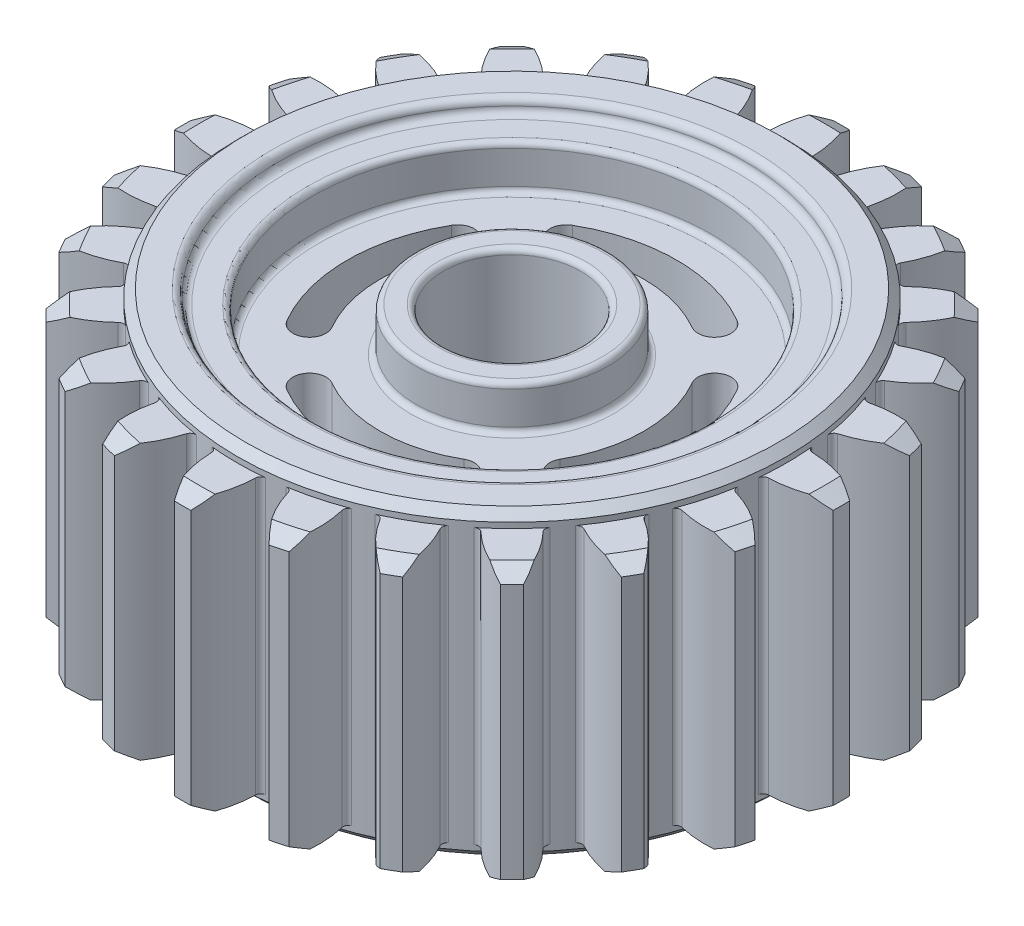
from build123d import *

# Parameters (mm, degrees)
SKETCH1_R           = 42.5
SKETCH1_R_2         = 12.5
BOSS_EXTRUDE1_DEPTH = 25
SKETCH1_3_R         = 50
SKETCH1_3_R_2       = 42.5
BOSS_EXTRUDE2_DEPTH = 27.5
BOSS_EXTRUDE3_DEPTH = 25
FILLET1_R           = 1.25
CHAMFER1_SIZE       = 1.5
FILLET2_R           = 1
SKETCH3_R           = 36.25
SKETCH3_R_2         = 17.5
CUT_EXTRUDE1_DEPTH  = 8
CUT_EXTRUDE2_REACH  = 97.814
FILLET3_R           = 1


with BuildPart() as part:
    # Sketch1 → Boss-Extrude1 (new, symmetric)
    with BuildSketch(Plane(origin=(0, 0, 0), x_dir=(1, 0, 0), z_dir=(0, 1, 0))):
        with Locations(Location((0, 0, 0), (0, 0, 270))):
            Circle(SKETCH1_R)
        with Locations(Location((0, 0, 0), (0, 0, 270))):
            Circle(SKETCH1_R_2, mode=Mode.SUBTRACT)
    extrude(amount=BOSS_EXTRUDE1_DEPTH, both=True)

    # Sketch1<3> → Boss-Extrude2 (add, symmetric)
    with BuildSketch(Plane(origin=(0, 0, 0), x_dir=(1, 0, 0), z_dir=(0, 1, 0))):
        with Locations(Location((0, 0, 0), (0, 0, 270))):
            Circle(SKETCH1_3_R)
        with Locations(Location((0, 0, 0), (0, 0, 270))):
            Circle(SKETCH1_3_R_2, mode=Mode.SUBTRACT)
    extrude(amount=BOSS_EXTRUDE2_DEPTH, both=True)

    # Sketch1<4> → Boss-Extrude3 (add, symmetric)
    with BuildSketch(Plane(origin=(0, 0, 0), x_dir=(1, 0, 0), z_dir=(0, 1, 0))):
        with BuildLine():
            ThreePointArc((41.16248371, 28.383973204), (43.301270189, 25), (45.16248371, 21.455769974))
            ThreePointArc((45.16248371, 21.455769974), (49.409590507, 24.573240926), (52.695283713, 28.691585429))
            ThreePointArc((52.695283713, 28.691585429), (51.961524227, 30), (51.195283713, 31.28966164))
            ThreePointArc((51.195283713, 31.28966164), (45.985846149, 30.503340107), (41.16248371, 28.383973204))
        make_face()
        with BuildLine():
            ThreePointArc((47.10621893, 16.763178043), (48.296291314, 12.940952255), (49.176771291, 9.035771432))
            ThreePointArc((49.176771291, 9.035771432), (54.086022289, 10.947785012), (58.325664205, 14.075400351))
            ThreePointArc((58.325664205, 14.075400351), (57.955549577, 15.529142706), (57.54920707, 16.97317783))
            ThreePointArc((57.54920707, 16.97317783), (52.313761798, 17.561951209), (47.10621893, 16.763178043))
        make_face()
        with BuildLine():
            ThreePointArc((49.839743178, 4), (49.95991973, 2.001604497), (50, 0))
            ThreePointArc((50, 0), (49.95991973, -2.001604497), (49.839743178, -4))
            ThreePointArc((49.839743178, -4), (55.076581033, -3.423744359), (59.981247069, -1.5))
            ThreePointArc((59.981247069, -1.5), (59.995311584, -0.75005861), (60, 0))
            ThreePointArc((60, 0), (59.995311584, 0.75005861), (59.981247069, 1.5))
            ThreePointArc((59.981247069, 1.5), (55.076581033, 3.423744359), (49.839743178, 4))
        make_face()
        with BuildLine():
            ThreePointArc((58.325664205, -14.075400351), (54.086022289, -10.947785012), (49.176771291, -9.035771432))
            ThreePointArc((49.176771291, -9.035771432), (48.296291314, -12.940952255), (47.10621893, -16.763178043))
            ThreePointArc((47.10621893, -16.763178043), (52.313761798, -17.561951209), (57.54920707, -16.97317783))
            ThreePointArc((57.54920707, -16.97317783), (57.955549577, -15.529142706), (58.325664205, -14.075400351))
        make_face()
        with BuildLine():
            ThreePointArc((52.695283713, -28.691585429), (49.409590507, -24.573240926), (45.16248371, -21.455769974))
            ThreePointArc((45.16248371, -21.455769974), (43.301270189, -25), (41.16248371, -28.383973204))
            ThreePointArc((41.16248371, -28.383973204), (45.985846149, -30.503340107), (51.195283713, -31.28966164))
            ThreePointArc((51.195283713, -31.28966164), (51.961524227, -30), (52.695283713, -28.691585429))
        make_face()
        with BuildLine():
            ThreePointArc((43.473806719, -41.352486375), (41.365976786, -36.52407108), (38.070447498, -32.413593249))
            ThreePointArc((38.070447498, -32.413593249), (35.355339059, -35.355339059), (32.413593249, -38.070447498))
            ThreePointArc((32.413593249, -38.070447498), (36.52407108, -41.365976786), (41.352486375, -43.473806719))
            ThreePointArc((41.352486375, -43.473806719), (42.426406871, -42.426406871), (43.473806719, -41.352486375))
        make_face()
        with BuildLine():
            ThreePointArc((31.28966164, -51.195283713), (30.503340107, -45.985846149), (28.383973204, -41.16248371))
            ThreePointArc((28.383973204, -41.16248371), (25, -43.301270189), (21.455769974, -45.16248371))
            ThreePointArc((21.455769974, -45.16248371), (24.573240926, -49.409590507), (28.691585429, -52.695283713))
            ThreePointArc((28.691585429, -52.695283713), (30, -51.961524227), (31.28966164, -51.195283713))
        make_face()
        with BuildLine():
            ThreePointArc((16.97317783, -57.54920707), (17.561951209, -52.313761798), (16.763178043, -47.10621893))
            ThreePointArc((16.763178043, -47.10621893), (12.940952255, -48.296291314), (9.035771432, -49.176771291))
            ThreePointArc((9.035771432, -49.176771291), (10.947785012, -54.086022289), (14.075400351, -58.325664205))
            ThreePointArc((14.075400351, -58.325664205), (15.529142706, -57.955549577), (16.97317783, -57.54920707))
        make_face()
        with BuildLine():
            ThreePointArc((1.5, -59.981247069), (3.423744359, -55.076581033), (4, -49.839743178))
            ThreePointArc((4, -49.839743178), (0, -50), (-4, -49.839743178))
            ThreePointArc((-4, -49.839743178), (-3.423744359, -55.076581033), (-1.5, -59.981247069))
            ThreePointArc((-1.5, -59.981247069), (0, -60), (1.5, -59.981247069))
        make_face()
        with BuildLine():
            ThreePointArc((-14.075400351, -58.325664205), (-10.947785012, -54.086022289), (-9.035771432, -49.176771291))
            ThreePointArc((-9.035771432, -49.176771291), (-12.940952255, -48.296291314), (-16.763178043, -47.10621893))
            ThreePointArc((-16.763178043, -47.10621893), (-17.561951209, -52.313761798), (-16.97317783, -57.54920707))
            ThreePointArc((-16.97317783, -57.54920707), (-15.529142706, -57.955549577), (-14.075400351, -58.325664205))
        make_face()
        with BuildLine():
            ThreePointArc((-28.691585429, -52.695283713), (-24.573240926, -49.409590507), (-21.455769974, -45.16248371))
            ThreePointArc((-21.455769974, -45.16248371), (-25, -43.301270189), (-28.383973204, -41.16248371))
            ThreePointArc((-28.383973204, -41.16248371), (-30.503340107, -45.985846149), (-31.28966164, -51.195283713))
            ThreePointArc((-31.28966164, -51.195283713), (-30, -51.961524227), (-28.691585429, -52.695283713))
        make_face()
        with BuildLine():
            ThreePointArc((-41.352486375, -43.473806719), (-36.52407108, -41.365976786), (-32.413593249, -38.070447498))
            ThreePointArc((-32.413593249, -38.070447498), (-35.355339059, -35.355339059), (-38.070447498, -32.413593249))
            ThreePointArc((-38.070447498, -32.413593249), (-41.365976786, -36.52407108), (-43.473806719, -41.352486375))
            ThreePointArc((-43.473806719, -41.352486375), (-42.426406871, -42.426406871), (-41.352486375, -43.473806719))
        make_face()
        with BuildLine():
            ThreePointArc((-51.195283713, -31.28966164), (-45.985846149, -30.503340107), (-41.16248371, -28.383973204))
            ThreePointArc((-41.16248371, -28.383973204), (-43.301270189, -25), (-45.16248371, -21.455769974))
            ThreePointArc((-45.16248371, -21.455769974), (-49.409590507, -24.573240926), (-52.695283713, -28.691585429))
            ThreePointArc((-52.695283713, -28.691585429), (-51.961524227, -30), (-51.195283713, -31.28966164))
        make_face()
        with BuildLine():
            ThreePointArc((-57.54920707, -16.97317783), (-52.313761798, -17.561951209), (-47.10621893, -16.763178043))
            ThreePointArc((-47.10621893, -16.763178043), (-48.296291314, -12.940952255), (-49.176771291, -9.035771432))
            ThreePointArc((-49.176771291, -9.035771432), (-54.086022289, -10.947785012), (-58.325664205, -14.075400351))
            ThreePointArc((-58.325664205, -14.075400351), (-57.955549577, -15.529142706), (-57.54920707, -16.97317783))
        make_face()
        with BuildLine():
            ThreePointArc((-49.839743178, -4), (-50, 0), (-49.839743178, 4))
            ThreePointArc((-49.839743178, 4), (-55.076581033, 3.423744359), (-59.981247069, 1.5))
            ThreePointArc((-59.981247069, 1.5), (-60, 0), (-59.981247069, -1.5))
            ThreePointArc((-59.981247069, -1.5), (-55.076581033, -3.423744359), (-49.839743178, -4))
        make_face()
        with BuildLine():
            ThreePointArc((-49.176771291, 9.035771432), (-48.296291314, 12.940952255), (-47.10621893, 16.763178043))
            ThreePointArc((-47.10621893, 16.763178043), (-52.313761798, 17.561951209), (-57.54920707, 16.97317783))
            ThreePointArc((-57.54920707, 16.97317783), (-57.955549577, 15.529142706), (-58.325664205, 14.075400351))
            ThreePointArc((-58.325664205, 14.075400351), (-54.086022289, 10.947785012), (-49.176771291, 9.035771432))
        make_face()
        with BuildLine():
            ThreePointArc((-45.16248371, 21.455769974), (-43.301270189, 25), (-41.16248371, 28.383973204))
            ThreePointArc((-41.16248371, 28.383973204), (-45.985846149, 30.503340107), (-51.195283713, 31.28966164))
            ThreePointArc((-51.195283713, 31.28966164), (-51.961524227, 30), (-52.695283713, 28.691585429))
            ThreePointArc((-52.695283713, 28.691585429), (-49.409590507, 24.573240926), (-45.16248371, 21.455769974))
        make_face()
        with BuildLine():
            ThreePointArc((-38.070447498, 32.413593249), (-35.355339059, 35.355339059), (-32.413593249, 38.070447498))
            ThreePointArc((-32.413593249, 38.070447498), (-36.52407108, 41.365976786), (-41.352486375, 43.473806719))
            ThreePointArc((-41.352486375, 43.473806719), (-42.426406871, 42.426406871), (-43.473806719, 41.352486375))
            ThreePointArc((-43.473806719, 41.352486375), (-41.365976786, 36.52407108), (-38.070447498, 32.413593249))
        make_face()
        with BuildLine():
            ThreePointArc((-28.383973204, 41.16248371), (-25, 43.301270189), (-21.455769974, 45.16248371))
            ThreePointArc((-21.455769974, 45.16248371), (-24.573240926, 49.409590507), (-28.691585429, 52.695283713))
            ThreePointArc((-28.691585429, 52.695283713), (-30, 51.961524227), (-31.28966164, 51.195283713))
            ThreePointArc((-31.28966164, 51.195283713), (-30.503340107, 45.985846149), (-28.383973204, 41.16248371))
        make_face()
        with BuildLine():
            ThreePointArc((-16.763178043, 47.10621893), (-12.940952255, 48.296291314), (-9.035771432, 49.176771291))
            ThreePointArc((-9.035771432, 49.176771291), (-10.947785012, 54.086022289), (-14.075400351, 58.325664205))
            ThreePointArc((-14.075400351, 58.325664205), (-15.529142706, 57.955549577), (-16.97317783, 57.54920707))
            ThreePointArc((-16.97317783, 57.54920707), (-17.561951209, 52.313761798), (-16.763178043, 47.10621893))
        make_face()
        with BuildLine():
            ThreePointArc((-4, 49.839743178), (0, 50), (4, 49.839743178))
            ThreePointArc((4, 49.839743178), (3.423744359, 55.076581033), (1.5, 59.981247069))
            ThreePointArc((1.5, 59.981247069), (0, 60), (-1.5, 59.981247069))
            ThreePointArc((-1.5, 59.981247069), (-3.423744359, 55.076581033), (-4, 49.839743178))
        make_face()
        with BuildLine():
            ThreePointArc((21.455769974, 45.16248371), (25, 43.301270189), (28.383973204, 41.16248371))
            ThreePointArc((28.383973204, 41.16248371), (30.503340107, 45.985846149), (31.28966164, 51.195283713))
            ThreePointArc((31.28966164, 51.195283713), (30, 51.961524227), (28.691585429, 52.695283713))
            ThreePointArc((28.691585429, 52.695283713), (24.573240926, 49.409590507), (21.455769974, 45.16248371))
        make_face()
        with BuildLine():
            ThreePointArc((32.413593249, 38.070447498), (35.355339059, 35.355339059), (38.070447498, 32.413593249))
            ThreePointArc((38.070447498, 32.413593249), (41.365976786, 36.52407108), (43.473806719, 41.352486375))
            ThreePointArc((43.473806719, 41.352486375), (42.426406871, 42.426406871), (41.352486375, 43.473806719))
            ThreePointArc((41.352486375, 43.473806719), (36.52407108, 41.365976786), (32.413593249, 38.070447498))
        make_face()
        with BuildLine():
            ThreePointArc((9.035771432, 49.176771291), (12.940952255, 48.296291314), (16.763178043, 47.10621893))
            ThreePointArc((16.763178043, 47.10621893), (17.561951209, 52.313761798), (16.97317783, 57.54920707))
            ThreePointArc((16.97317783, 57.54920707), (15.529142706, 57.955549577), (14.075400351, 58.325664205))
            ThreePointArc((14.075400351, 58.325664205), (10.947785012, 54.086022289), (9.035771432, 49.176771291))
        make_face()
    extrude(amount=BOSS_EXTRUDE3_DEPTH, both=True)

    # Fillet1
    fillet1_edges = [part.edges().sort_by_distance(p)[0] for p in [
        (0, -25, -42.5),
        (0, 25, -42.5),
        (0, 27.5, -42.5),
        (0, -27.5, -42.5),
    ]]
    fillet(fillet1_edges, radius=FILLET1_R - 0.0001)  # a hair under: the kernel refuses the full size

    # Chamfer1
    chamfer1_edges = [part.edges().sort_by_distance(p)[0] for p in [
        (0, -27.5, -50),
        (0, 27.5, -50),
    ]]
    chamfer(chamfer1_edges, length=CHAMFER1_SIZE)

    # Sketch2 → Cut-Revolve1 (revolve, cut)
    with BuildSketch(Plane.XY, mode=Mode.PRIVATE) as cut_revolve1_sk:
        Polygon((61.322639837, 25), (57, 25), (61.322639837, 22.504322727), align=None)
    cut_revolve1 = revolve(cut_revolve1_sk.sketch.rotate(Axis((0, 0, 0), (0, -1, 0)), 90), axis=Axis((0, 0, 0), (0, -1, 0)), mode=Mode.SUBTRACT)

    # Mirror1: Cut-Revolve1 across plane
    add(cut_revolve1.mirror(Plane.ZX), mode=Mode.SUBTRACT)

    # Fillet2
    fillet2_edges = [part.edges().sort_by_distance(p)[0] for p in [
        (4, 0, 49.839743178),
        (-4, 0, 49.839743178),
        (-9.035771432, 0, 49.176771291),
        (-16.763178043, 0, 47.10621893),
        (-21.455769974, 0, 45.16248371),
        (-28.383973204, 0, 41.16248371),
        (-32.413593249, 0, 38.070447498),
        (-38.070447498, 0, 32.413593249),
        (-41.16248371, 0, 28.383973204),
        (-45.16248371, 0, 21.455769974),
        (-47.10621893, 0, 16.763178043),
        (-49.176771291, 0, 9.035771432),
        (-49.839743178, 0, 4),
        (-49.839743178, 0, -4),
        (-49.176771291, 0, -9.035771432),
        (-47.10621893, 0, -16.763178043),
        (41.16248371, 0, -28.383973204),
        (-45.16248371, 0, -21.455769974),
        (45.16248371, 0, -21.455769974),
        (-41.16248371, 0, -28.383973204),
        (-38.070447498, 0, -32.413593249),
        (-32.413593249, 0, -38.070447498),
        (-28.383973204, 0, -41.16248371),
        (-21.455769974, 0, -45.16248371),
        (-16.763178043, 0, -47.10621893),
        (-9.035771432, 0, -49.176771291),
        (-4, 0, -49.839743178),
        (4, 0, -49.839743178),
        (21.455769974, 0, -45.16248371),
        (28.383973204, 0, -41.16248371),
        (32.413593249, 0, -38.070447498),
        (38.070447498, 0, -32.413593249),
        (9.035771432, 0, -49.176771291),
        (16.763178043, 0, -47.10621893),
        (47.10621893, 0, -16.763178043),
        (49.176771291, 0, -9.035771432),
        (49.839743178, 0, -4),
        (49.839743178, 0, 4),
        (49.176771291, 0, 9.035771432),
        (47.10621893, 0, 16.763178043),
        (45.16248371, 0, 21.455769974),
        (41.16248371, 0, 28.383973204),
        (38.070447498, 0, 32.413593249),
        (32.413593249, 0, 38.070447498),
        (28.383973204, 0, 41.16248371),
        (21.455769974, 0, 45.16248371),
        (16.763178043, 0, 47.10621893),
        (9.035771432, 0, 49.176771291),
    ]]
    fillet(fillet2_edges, radius=FILLET2_R)

    # Sketch3 → Cut-Extrude1 (cut)
    with BuildSketch(Plane(origin=(0, 25, 0), x_dir=(1, 0, 0), z_dir=(0, 1, 0))):
        with Locations(Location((0, 0, 0), (0, 0, 270))):
            Circle(SKETCH3_R)
        with Locations(Location((0, 0, 0), (0, 0, 270))):
            Circle(SKETCH3_R_2, mode=Mode.SUBTRACT)
    cut_extrude1 = extrude(amount=-CUT_EXTRUDE1_DEPTH, mode=Mode.SUBTRACT)

    # Mirror2: Cut-Extrude1 across plane
    add(cut_extrude1.mirror(Plane.ZX), mode=Mode.SUBTRACT)

    # Sketch4 → Cut-Extrude2 (cut, up to next)
    with BuildSketch(Plane(origin=(0, 17, 0), x_dir=(1, 0, 0), z_dir=(0, 1, 0)), mode=Mode.PRIVATE) as cut_extrude2_sk1:
        with BuildLine():
            ThreePointArc((25.980762114, -15), (30, 0), (25.980762114, 15))
            ThreePointArc((25.980762114, 15), (21.882685902, 16.098076211), (20.784609691, 12))
            ThreePointArc((20.784609691, 12), (24, 0), (20.784609691, -12))
            ThreePointArc((20.784609691, -12), (21.882685902, -16.098076211), (25.980762114, -15))
        make_face()
    cut_extrude2_tool1 = extrude(cut_extrude2_sk1.sketch, amount=-CUT_EXTRUDE2_REACH, mode=Mode.PRIVATE) & part.part
    # Sketch4 → Cut-Extrude2 (cut, up to next)
    with BuildSketch(Plane(origin=(0, 17, 0), x_dir=(1, 0, 0), z_dir=(0, 1, 0)), mode=Mode.PRIVATE) as cut_extrude2_sk2:
        with BuildLine():
            ThreePointArc((-15, -25.980762114), (0, -30), (15, -25.980762114))
            ThreePointArc((15, -25.980762114), (16.098076211, -21.882685902), (12, -20.784609691))
            ThreePointArc((12, -20.784609691), (0, -24), (-12, -20.784609691))
            ThreePointArc((-12, -20.784609691), (-16.098076211, -21.882685902), (-15, -25.980762114))
        make_face()
    cut_extrude2_tool2 = extrude(cut_extrude2_sk2.sketch, amount=-CUT_EXTRUDE2_REACH, mode=Mode.PRIVATE) & part.part
    # Sketch4 → Cut-Extrude2 (cut, up to next)
    with BuildSketch(Plane(origin=(0, 17, 0), x_dir=(1, 0, 0), z_dir=(0, 1, 0)), mode=Mode.PRIVATE) as cut_extrude2_sk3:
        with BuildLine():
            ThreePointArc((-25.980762114, 15), (-30, 0), (-25.980762114, -15))
            ThreePointArc((-25.980762114, -15), (-21.882685902, -16.098076211), (-20.784609691, -12))
            ThreePointArc((-20.784609691, -12), (-24, 0), (-20.784609691, 12))
            ThreePointArc((-20.784609691, 12), (-21.882685902, 16.098076211), (-25.980762114, 15))
        make_face()
    cut_extrude2_tool3 = extrude(cut_extrude2_sk3.sketch, amount=-CUT_EXTRUDE2_REACH, mode=Mode.PRIVATE) & part.part
    # Sketch4 → Cut-Extrude2 (cut, up to next)
    with BuildSketch(Plane(origin=(0, 17, 0), x_dir=(1, 0, 0), z_dir=(0, 1, 0)), mode=Mode.PRIVATE) as cut_extrude2_sk4:
        with BuildLine():
            ThreePointArc((15, 25.980762114), (0, 30), (-15, 25.980762114))
            ThreePointArc((-15, 25.980762114), (-16.098076211, 21.882685902), (-12, 20.784609691))
            ThreePointArc((-12, 20.784609691), (0, 24), (12, 20.784609691))
            ThreePointArc((12, 20.784609691), (16.098076211, 21.882685902), (15, 25.980762114))
        make_face()
    cut_extrude2_tool4 = extrude(cut_extrude2_sk4.sketch, amount=-CUT_EXTRUDE2_REACH, mode=Mode.PRIVATE) & part.part
    add(cut_extrude2_tool1.solids().sort_by_distance((25.440184, 17, 0))[0], mode=Mode.SUBTRACT)
    add(cut_extrude2_tool2.solids().sort_by_distance((0, 17, 25.440184))[0], mode=Mode.SUBTRACT)
    add(cut_extrude2_tool3.solids().sort_by_distance((-25.440184, 17, 0))[0], mode=Mode.SUBTRACT)
    add(cut_extrude2_tool4.solids().sort_by_distance((0, 17, -25.440184))[0], mode=Mode.SUBTRACT)

    # Fillet3
    fillet3_edges = [part.edges().sort_by_distance(p)[0] for p in [
        (0, 25, -17.5),
        (0, 17, -36.25),
        (0, 17, -17.5),
        (0, 25, -36.25),
        (0, -17, -17.5),
        (0, -25, -36.25),
        (0, -17, -36.25),
        (0, -25, -17.5),
        (0, 25, -12.5),
    ]]
    fillet(fillet3_edges, radius=FILLET3_R)


solid = part.part
